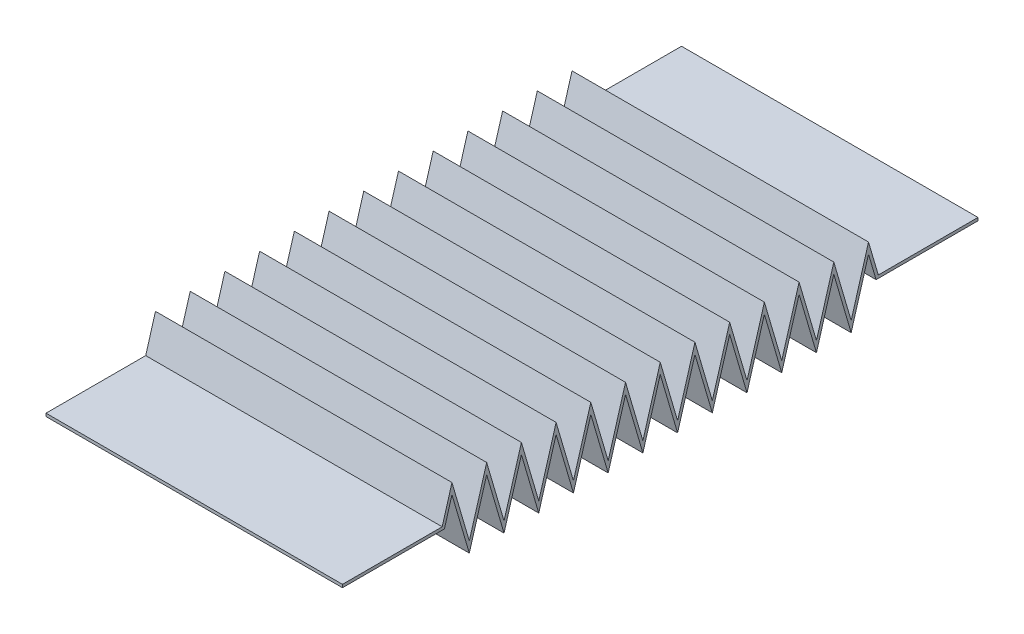
from build123d import *

# Parameters (mm, degrees)
EXTRUDE_THIN1_DEPTH = 25


with BuildPart() as part:
    # Sketch3 → Extrude-Thin1 (new, symmetric)
    with BuildSketch(Plane(origin=(0, 0, 0), x_dir=(0, 0, -1), z_dir=(1, 0, 0))):
        Polygon((0, 4.75), (17.187312397, 4.75), (18.463547865, 9.110074236), (21.390643594, -0.889925764), (24.317739323, 9.110074236), (27.244835052, -0.889925764), (30.171930781, 9.110074236), (33.09902651, -0.889925764), (36.026122239, 9.110074236), (38.953217969, -0.889925764), (41.880313698, 9.110074236), (44.807409427, -0.889925764), (47.734505156, 9.110074236), (50.661600885, -0.889925764), (53.588696614, 9.110074236), (56.515792343, -0.889925764), (59.442888073, 9.110074236), (62.369983802, -0.889925764), (65.297079531, 9.110074236), (68.22417526, -0.889925764), (71.151270989, 9.110074236), (74.078366718, -0.889925764), (77.005462447, 9.110074236), (79.932558177, -0.889925764), (82.859653906, 9.110074236), (85.786749635, -0.889925764), (88.713845364, 9.110074236), (89.990080831, 4.75), (107.177393229, 4.75), (107.177393229, 5.25), (90.364705626, 5.25), (88.713845364, 10.889925764), (85.786749635, 0.889925764), (82.859653906, 10.889925764), (79.932558177, 0.889925764), (77.005462447, 10.889925764), (74.078366718, 0.889925764), (71.151270989, 10.889925764), (68.22417526, 0.889925764), (65.297079531, 10.889925764), (62.369983802, 0.889925764), (59.442888073, 10.889925764), (56.515792343, 0.889925764), (53.588696614, 10.889925764), (50.661600885, 0.889925764), (47.734505156, 10.889925764), (44.807409427, 0.889925764), (41.880313698, 10.889925764), (38.953217969, 0.889925764), (36.026122239, 10.889925764), (33.09902651, 0.889925764), (30.171930781, 10.889925764), (27.244835052, 0.889925764), (24.317739323, 10.889925764), (21.390643594, 0.889925764), (18.463547865, 10.889925764), (16.812687603, 5.25), (0, 5.25), align=None)
    extrude(amount=EXTRUDE_THIN1_DEPTH, both=True)


solid = part.part
